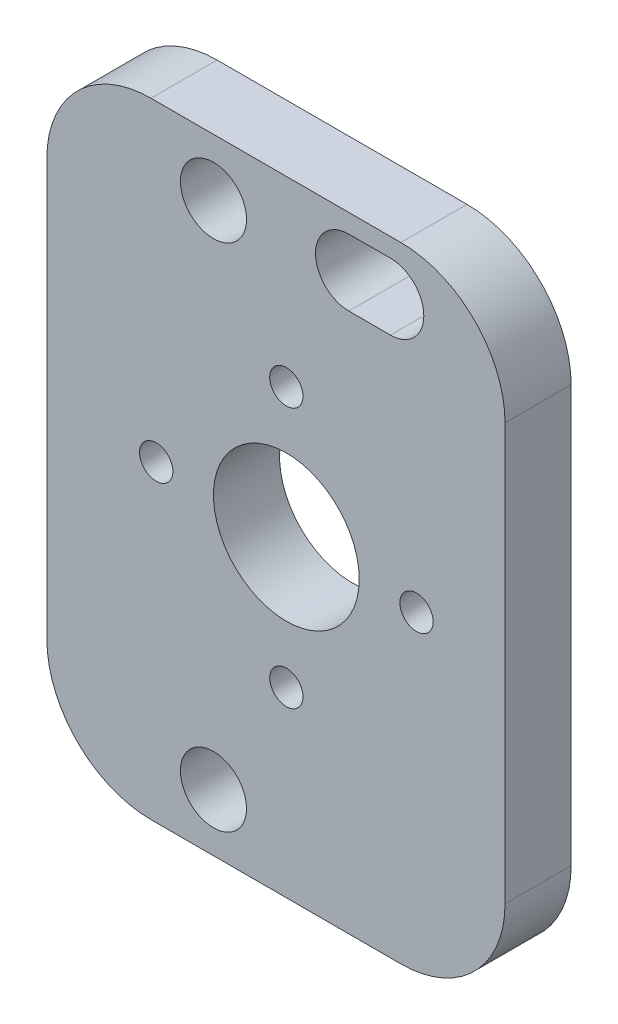
from build123d import *

# Parameters (mm, degrees)
SKETCH2_W            = 44
SKETCH2_H            = 60
SKETCH2_R            = 7
SKETCH2_R_2          = 3.175
BOSS_EXTRUDE1_DEPTH  = 3.175
M3_CLEARANCE_HOLE1_D = 3.2
FILLET1_R            = 10
CUT_EXTRUDE1_DEPTH   = 39.331742721


with BuildPart() as part:
    # Sketch2 → Boss-Extrude1 (new, symmetric)
    with BuildSketch(Plane.XY):
        with Locations((-1, 0)):
            Rectangle(SKETCH2_W, SKETCH2_H)
        Circle(SKETCH2_R, mode=Mode.SUBTRACT)
        with Locations((-7, 24.5)):
            Circle(SKETCH2_R_2, mode=Mode.SUBTRACT)
        with Locations((-7, -24.5)):
            Circle(SKETCH2_R_2, mode=Mode.SUBTRACT)
    extrude(amount=BOSS_EXTRUDE1_DEPTH, both=True)

    # M3 Clearance Hole1 (through all)
    with Locations(Plane.XY.offset(3.175)):
        with Locations((0, 12.5), (12.5, 0), (0, -12.5), (-12.5, 0)):
            Hole(M3_CLEARANCE_HOLE1_D / 2)

    # Fillet1
    fillet1_edges = [part.edges().sort_by_distance(p)[0] for p in [
        (21, -30, 0),
        (21, 30, 0),
        (-23, -30, 0),
        (-23, 30, 0),
    ]]
    fillet(fillet1_edges, radius=FILLET1_R)

    # Sketch5 → Cut-Extrude1 (cut, through all)
    with BuildSketch(Plane.XY.offset(3.175)):
        with BuildLine():
            Line((6, 28.2), (10, 28.2))
            ThreePointArc((10, 28.2), (13.2, 25), (10, 21.8))
            Line((10, 21.8), (6, 21.8))
            ThreePointArc((6, 21.8), (2.8, 25), (6, 28.2))
        make_face()
    extrude(amount=-CUT_EXTRUDE1_DEPTH, mode=Mode.SUBTRACT)


solid = part.part
